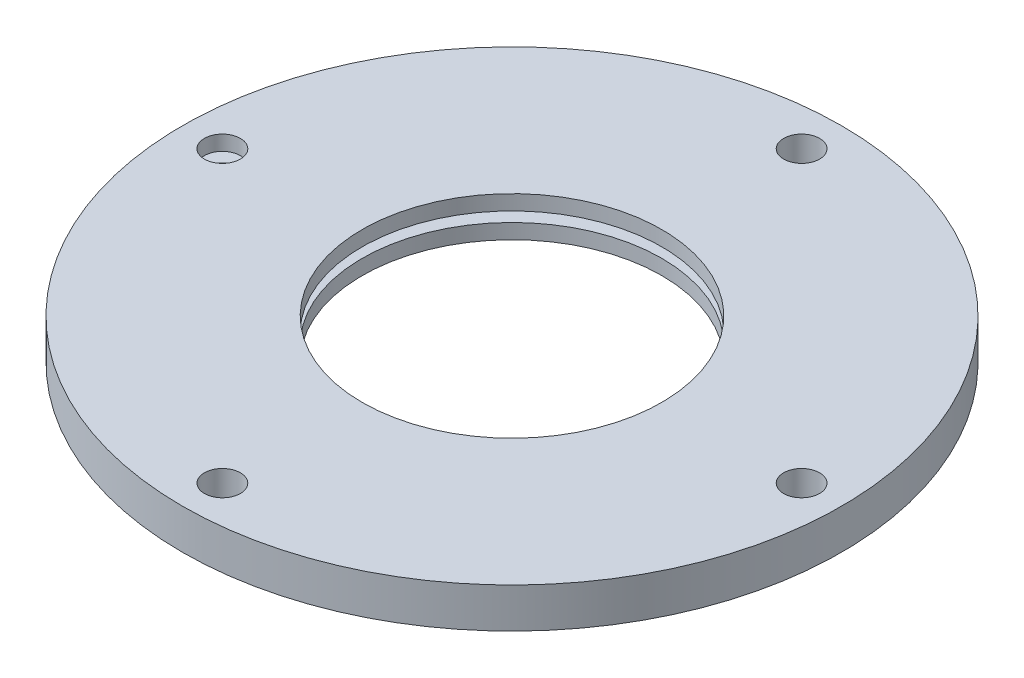
from build123d import *

# Parameters (mm, degrees)
SKETCH1_R                                       = 33
SKETCH1_R_2                                     = 1.5
BOSS_EXTRUDE1_DEPTH                             = 4
CSK_FOR_M3_FLAT_HEAD_MACHINE_SCREW1_D           = 3.6
CSK_FOR_M3_FLAT_HEAD_MACHINE_SCREW1_CSINK_D     = 6.3
CSK_FOR_M3_FLAT_HEAD_MACHINE_SCREW1_CSINK_ANGLE = 90
CORTAR_EXTRUIR1_REACH                           = 48.84
CROQUIS1_R                                      = 15
CROQUIS2_W                                      = 40
CROQUIS2_H                                      = 1
CORTAR_EXTRUIR2_DEPTH                           = 50


with BuildPart() as part:
    # Sketch1 → Boss-Extrude1 (new body)
    with BuildSketch(Plane(origin=(0, 0, 0), x_dir=(1, 0, 0), z_dir=(0, 1, 0))):
        Circle(SKETCH1_R)
        with Locations((-29, 0)):
            Circle(SKETCH1_R_2, mode=Mode.SUBTRACT)
        with Locations((0, 29)):
            Circle(SKETCH1_R_2, mode=Mode.SUBTRACT)
        with Locations((29, 0)):
            Circle(SKETCH1_R_2, mode=Mode.SUBTRACT)
        with Locations((0, -29)):
            Circle(SKETCH1_R_2, mode=Mode.SUBTRACT)
    extrude(amount=BOSS_EXTRUDE1_DEPTH)

    # CSK for M3 Flat Head Machine Screw1 (through all)
    with Locations(Plane(origin=(0, 0, 0), x_dir=(-1, 0, 0), z_dir=(0, -1, 0))):
        with Locations((0, -29), (29, 0), (0, 29), (-29, 0)):
            CounterSinkHole(CSK_FOR_M3_FLAT_HEAD_MACHINE_SCREW1_D / 2, CSK_FOR_M3_FLAT_HEAD_MACHINE_SCREW1_CSINK_D / 2, counter_sink_angle=CSK_FOR_M3_FLAT_HEAD_MACHINE_SCREW1_CSINK_ANGLE)

    # Croquis1 → Cortar-Extruir1 (cut, up to next)
    with BuildSketch(Plane.XZ, mode=Mode.PRIVATE) as cortar_extruir1_sk1:
        Circle(CROQUIS1_R)
    cortar_extruir1_tool1 = extrude(cortar_extruir1_sk1.sketch, amount=-CORTAR_EXTRUIR1_REACH, mode=Mode.PRIVATE) & part.part
    add(cortar_extruir1_tool1.solids().sort_by_distance((0, 0, 0))[0], mode=Mode.SUBTRACT)

    # Croquis2 → Cortar-Extruir2 (cut)
    with BuildSketch(Plane.ZY.offset(33)):
        with Locations((0, 2)):
            Rectangle(CROQUIS2_W, CROQUIS2_H)
    extrude(amount=-CORTAR_EXTRUIR2_DEPTH, mode=Mode.SUBTRACT)


solid = part.part
